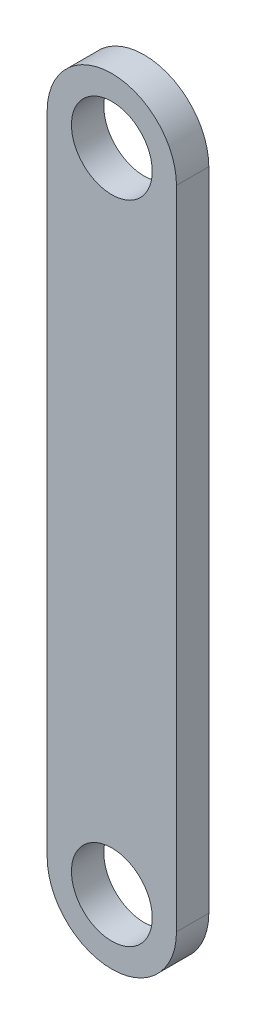
from build123d import *

# Parameters (mm, degrees)
SKETCH1_R           = 3.175
BOSS_EXTRUDE1_DEPTH = 2.54


with BuildPart() as part:
    # Sketch1 → Boss-Extrude1 (new body)
    with BuildSketch(Plane.XY):
        with BuildLine():
            Line((-5.08, 0), (-5.08, -50.8))
            ThreePointArc((-5.08, -50.8), (0, -55.88), (5.08, -50.8))
            Line((5.08, -50.8), (5.08, 0))
            ThreePointArc((5.08, 0), (0, 5.08), (-5.08, 0))
        make_face()
        Circle(SKETCH1_R, mode=Mode.SUBTRACT)
        with Locations((0, -50.8)):
            Circle(SKETCH1_R, mode=Mode.SUBTRACT)
    extrude(amount=BOSS_EXTRUDE1_DEPTH)


solid = part.part
